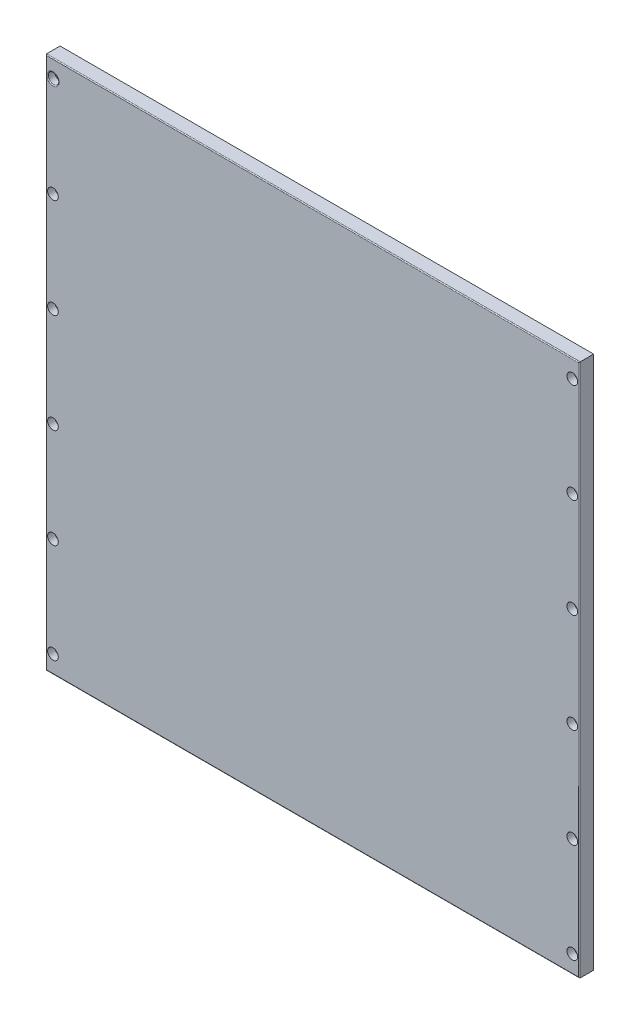
from build123d import *

# Parameters (mm, degrees)
SKETCH1_W            = 300
SKETCH1_H            = 300
BOSS_EXTRUDE1_DEPTH  = 8
SKETCH4_R            = 3
CUT_EXTRUDE2_DEPTH   = 4
CUT_EXTRUDE5_REACH   = 426.283
SKETCH7_R            = 1.5
FILLET1_R            = 0.5
LPATTERN1_COUNT      = 2
LPATTERN1_PITCH      = 292
LPATTERN1_COUNT_DIR2 = 6
LPATTERN1_PITCH_DIR2 = 56


with BuildPart() as part:
    # Sketch1 → Boss-Extrude1 (new body)
    with BuildSketch(Plane.XY):
        with Locations((150, 150)):
            Rectangle(SKETCH1_W, SKETCH1_H)
    extrude(amount=BOSS_EXTRUDE1_DEPTH)

    # Sketch4 → Cut-Extrude2 (cut)
    with BuildSketch(Plane.XY.offset(8)):
        with Locations((4, 290)):
            Circle(SKETCH4_R)
    cut_extrude2 = extrude(amount=-CUT_EXTRUDE2_DEPTH, mode=Mode.SUBTRACT)

    # Sketch7 → Cut-Extrude5 (cut, up to next)
    with BuildSketch(Plane.XY.offset(4), mode=Mode.PRIVATE) as cut_extrude5_sk1:
        with Locations((4, 290)):
            Circle(SKETCH7_R)
    cut_extrude5_tool1 = extrude(cut_extrude5_sk1.sketch, amount=-CUT_EXTRUDE5_REACH, mode=Mode.PRIVATE) & part.part
    cut_extrude5 = cut_extrude5_tool1.solids().sort_by_distance((4, 290, 4))[0]
    add(cut_extrude5, mode=Mode.SUBTRACT)

    # Fillet1
    fillet1_edges = [part.edges().sort_by_distance(p)[0] for p in [
        (300, 150, 8),
        (150, 300, 8),
        (1, 290, 8),
        (0, 150, 8),
        (150, 0, 8),
    ]]
    fillet(fillet1_edges, radius=FILLET1_R - 0.0001)  # a hair under: the kernel refuses the full size

    # LPattern1: Cut-Extrude2, Cut-Extrude5 2 × 6
    with Locations(*[(i * LPATTERN1_PITCH, -j * LPATTERN1_PITCH_DIR2, 0) for i in range(LPATTERN1_COUNT) for j in range(LPATTERN1_COUNT_DIR2) if (i, j) != (0, 0)]):
        add(cut_extrude2, mode=Mode.SUBTRACT)
        add(cut_extrude5, mode=Mode.SUBTRACT)


solid = part.part
